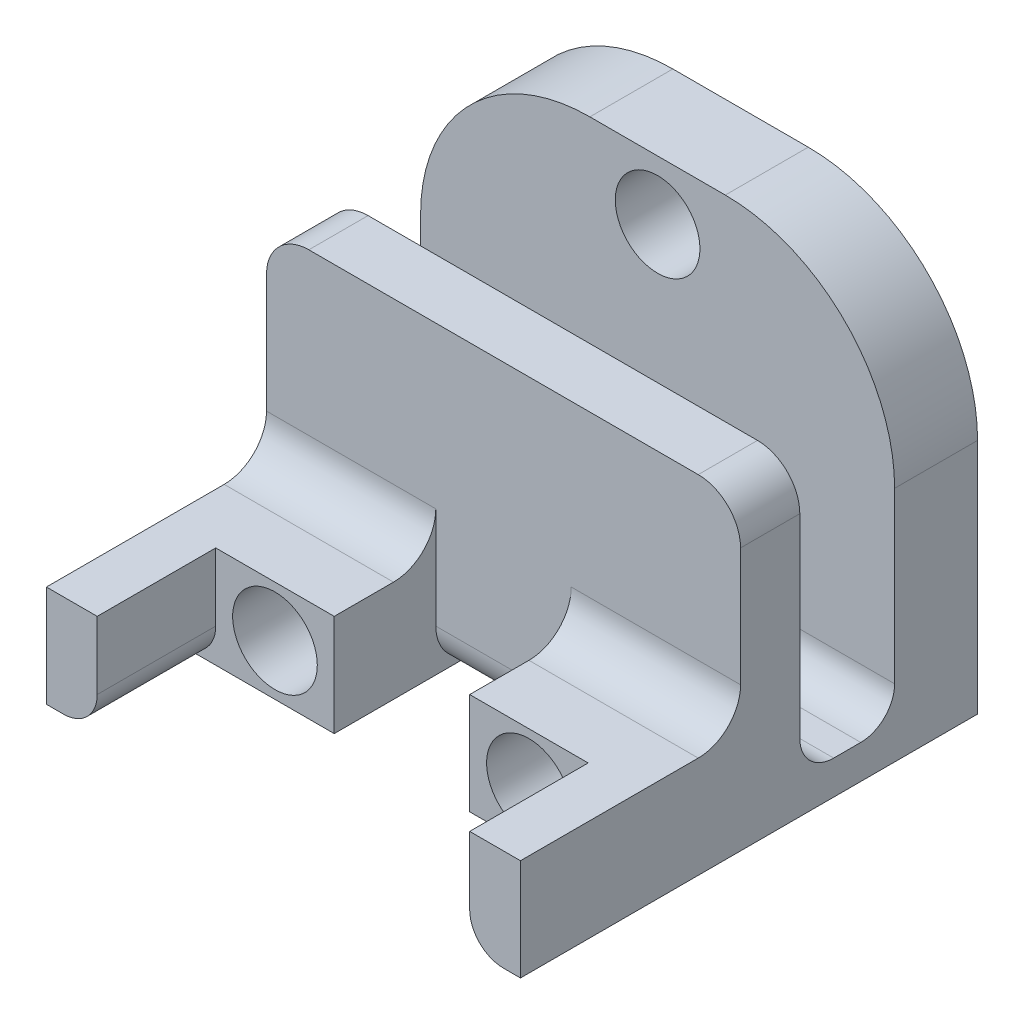
from build123d import *

# Parameters (mm, degrees)
BOSS_EXTRUDE1_DEPTH = 7.62
SKETCH2_W           = 35.56
SKETCH2_H           = 17.78
BOSS_EXTRUDE2_DEPTH = 22.86
SKETCH4_W           = 35.56
SKETCH4_H           = 7.112
CUT_EXTRUDE2_DEPTH  = 27.94
SKETCH5_W           = 35.56
SKETCH5_H           = 4.445
CUT_EXTRUDE3_DEPTH  = 7.62
SKETCH6_R           = 3.175
CUT_EXTRUDE4_DEPTH  = 6.35
SKETCH7_R           = 3.175
CUT_EXTRUDE5_DEPTH  = 9.525
FILLET1_R           = 12.7
FILLET2_R           = 3.175
FILLET3_R           = 3.175
FILLET5_R           = 3.175
FILLET6_R           = 2.54


with BuildPart() as part:
    # Sketch1 → Boss-Extrude1 (new body)
    with BuildSketch(Plane(origin=(0, 0, 0), x_dir=(1, 0, 0), z_dir=(0, 1, 0))):
        Polygon((0, 25.4), (0, 0), (0, -8.89), (3.81, -8.89), (3.81, 0), (12.7, 0), (12.7, 7.62), (22.86, 7.62), (22.86, 0), (31.75, 0), (31.75, -8.89), (35.56, -8.89), (35.56, 0), (35.56, 25.4), align=None)
    extrude(amount=BOSS_EXTRUDE1_DEPTH)

    # Sketch2 → Boss-Extrude2 (add)
    with BuildSketch(Plane(origin=(0, 7.62, 0), x_dir=(1, 0, 0), z_dir=(0, 1, 0))):
        with Locations((17.78, 16.51)):
            Rectangle(SKETCH2_W, SKETCH2_H)
    extrude(amount=BOSS_EXTRUDE2_DEPTH)

    # Sketch4 → Cut-Extrude2 (cut)
    with BuildSketch(Plane(origin=(0, 30.48, 0), x_dir=(1, 0, 0), z_dir=(0, 1, 0))):
        with Locations((17.78, 15.621)):
            Rectangle(SKETCH4_W, SKETCH4_H)
    extrude(amount=-CUT_EXTRUDE2_DEPTH, mode=Mode.SUBTRACT)

    # Sketch5 → Cut-Extrude3 (cut)
    with BuildSketch(Plane(origin=(0, 30.48, 0), x_dir=(1, 0, 0), z_dir=(0, 1, 0))):
        with Locations((17.78, 9.8425)):
            Rectangle(SKETCH5_W, SKETCH5_H)
    extrude(amount=-CUT_EXTRUDE3_DEPTH, mode=Mode.SUBTRACT)

    # Sketch6 → Cut-Extrude4 (cut)
    with BuildSketch(Plane(origin=(0, 0, -25.4), x_dir=(-1, 0, 0), z_dir=(0, 0, -1))):
        with Locations((-17.78, 26.035)):
            Circle(SKETCH6_R)
    extrude(amount=-CUT_EXTRUDE4_DEPTH, mode=Mode.SUBTRACT)

    # Sketch7 → Cut-Extrude5 (cut)
    with BuildSketch(Plane.XY):
        with Locations((27.305, 3.81)):
            Circle(SKETCH7_R)
        with Locations((8.255, 3.81)):
            Circle(SKETCH7_R)
    extrude(amount=-CUT_EXTRUDE5_DEPTH, mode=Mode.SUBTRACT)

    # Fillet1
    fillet1_edges = [part.edges().sort_by_distance(p)[0] for p in [
        (0, 30.48, -22.2885),
        (35.56, 30.48, -22.2885),
    ]]
    fillet(fillet1_edges, radius=FILLET1_R)

    # Fillet2
    fillet2_edges = [part.edges().sort_by_distance(p)[0] for p in [
        (0, 22.86, -9.8425),
        (35.56, 22.86, -9.8425),
    ]]
    fillet(fillet2_edges, radius=FILLET2_R)

    # Fillet3
    fillet3_edges = [part.edges().sort_by_distance(p)[0] for p in [
        (17.78, 0, -7.62),
    ]]
    fillet(fillet3_edges, radius=FILLET3_R)

    # Fillet5
    fillet5_edges = [part.edges().sort_by_distance(p)[0] for p in [
        (29.21, 7.62, -7.62),
        (6.35, 7.62, -7.62),
    ]]
    fillet(fillet5_edges, radius=FILLET5_R)

    # Fillet6
    fillet6_edges = [part.edges().sort_by_distance(p)[0] for p in [
        (3.81, 0, 4.445),
        (31.75, 0, 4.445),
        (17.78, 2.54, -12.065),
        (17.78, 2.54, -19.177),
    ]]
    fillet(fillet6_edges, radius=FILLET6_R)


solid = part.part
